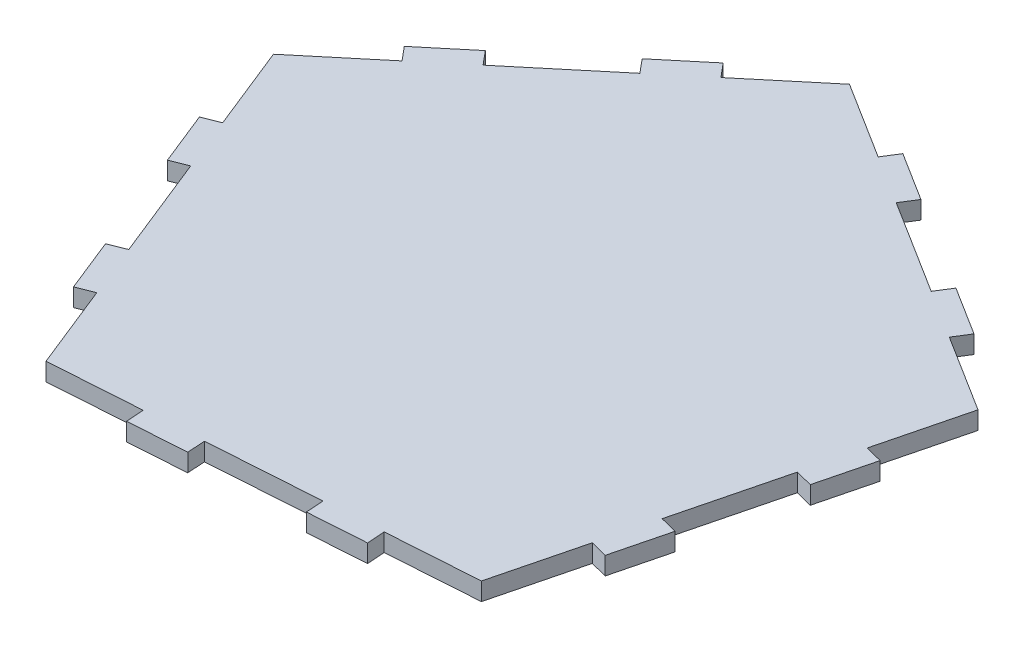
from build123d import *

# Parameters (mm, degrees)
BOSS_EXTRUDE1_DEPTH = 3.18
CUT_EXTRUDE2_DEPTH  = 10
CIRPATTERN2_COUNT   = 5


with BuildPart() as part:
    # Sketch1 → Boss-Extrude1 (new body)
    with BuildSketch(Plane(origin=(0, 0, 0), x_dir=(1, 0, 0), z_dir=(0, 1, 0))):
        Polygon((-63.737105075, 16.079573621), (-34.988431912, -55.6487276), (42.113064941, -50.472378708), (61.015737415, 24.455082065), (-4.403265369, 65.586450623), align=None)
    extrude(amount=BOSS_EXTRUDE1_DEPTH)

    # Sketch3 → Cut-Extrude2 (cut)
    with BuildSketch(Plane.XZ):
        Polygon((-53.89255863, -0.064994827), (-56.844299958, 1.118061864), (-63.737105075, -16.079573621), (-61.169762168, -18.221709207), align=None)
        Polygon((-53.042149209, 10.604475816), (-50.090407881, 9.421419125), (-42.731646451, 27.781621472), (-45.683387778, 28.964678163), align=None)
        Polygon((-34.988431912, 55.6487276), (-41.881237029, 38.451092116), (-38.929495702, 37.268035425), (-31.652292163, 55.424749805), align=None)
    cut_extrude2 = extrude(amount=-CUT_EXTRUDE2_DEPTH, mode=Mode.SUBTRACT)

    # CirPattern2: Cut-Extrude2 ×5 about axis
    cirpattern2_axis = Axis((0, 3.339, 0), (0, -1, 0))
    for i in range(1, CIRPATTERN2_COUNT):
        add(cut_extrude2.rotate(cirpattern2_axis, i * 360 / CIRPATTERN2_COUNT), mode=Mode.SUBTRACT)


solid = part.part
